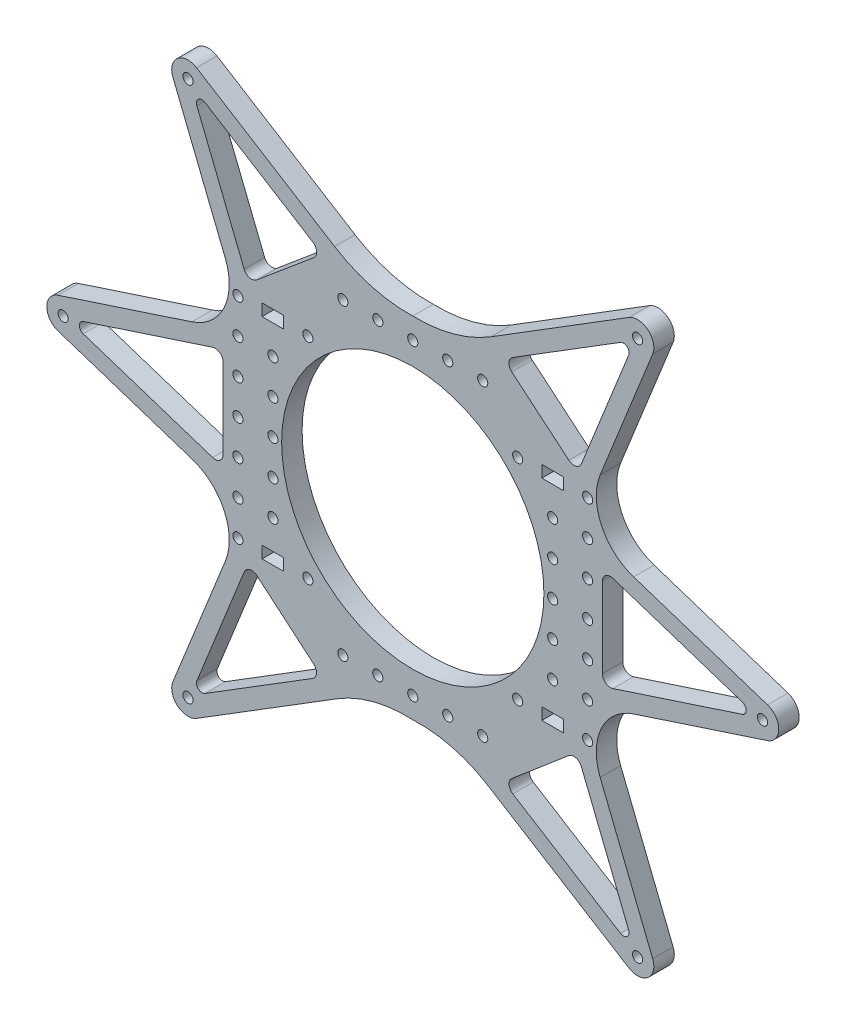
from build123d import *

# Parameters (mm, degrees)
SKETCH1_R           = 1.450000006
SKETCH1_R_2         = 1.45
SKETCH1_R_3         = 37.5
SKETCH1_W           = 6.2
SKETCH1_H           = 3.4
BOSS_EXTRUDE1_DEPTH = 5.85


with BuildPart() as part:
    # Sketch1 → Boss-Extrude1 (new body)
    with BuildSketch(Plane.XY):
        with BuildLine():
            Line((587.995290395, 497.753361998), (603.001149052, 460.347016836))
            ThreePointArc((603.001149052, 460.347016836), (602.663461243, 448.032016356), (593.446685098, 439.857402764))
            Line((593.446685098, 439.857402764), (555.146182231, 427.30822221))
            ThreePointArc((555.146182231, 427.30822221), (551.939243509, 422.882775531), (555.146182231, 418.457328853))
            Line((555.146182231, 418.457328853), (593.452097774, 405.906374832))
            ThreePointArc((593.452097774, 405.906374832), (602.673069636, 397.726980073), (603.008552552, 385.405605479))
            Line((603.008552552, 385.405605479), (587.996958268, 348.012810768))
            ThreePointArc((587.996958268, 348.012810768), (589.323596956, 342.712965063), (594.773022858, 342.32297527))
            Line((594.773022858, 342.32297527), (634.994066481, 367.293384987))
            ThreePointArc((634.994066481, 367.293384987), (645.369310006, 371.733785793), (656.596182238, 372.882775531))
            ThreePointArc((656.596182238, 372.882775531), (667.823054469, 371.733785793), (678.198297995, 367.293384987))
            Line((678.198297995, 367.293384987), (718.419341617, 342.32297527))
            ThreePointArc((718.419341617, 342.32297527), (723.86876752, 342.712965063), (725.195406208, 348.012810768))
            Line((725.195406208, 348.012810768), (710.183811924, 385.405605479))
            ThreePointArc((710.183811924, 385.405605479), (710.51929484, 397.726980073), (719.740266702, 405.906374832))
            Line((719.740266702, 405.906374832), (758.046182244, 418.457328853))
            ThreePointArc((758.046182244, 418.457328853), (761.253120966, 422.882775531), (758.046182244, 427.30822221))
            Line((758.046182244, 427.30822221), (719.745679378, 439.857402764))
            ThreePointArc((719.745679378, 439.857402764), (710.528903233, 448.032016356), (710.191215423, 460.347016836))
            Line((710.191215423, 460.347016836), (725.197074081, 497.753361998))
            ThreePointArc((725.197074081, 497.753361998), (723.86836572, 503.054641878), (718.416896408, 503.442606583))
            Line((718.416896408, 503.442606583), (678.956477699, 478.92021162))
            ThreePointArc((678.956477699, 478.92021162), (668.220713078, 474.255672819), (656.596182238, 472.882775531))
            ThreePointArc((656.596182238, 472.882775531), (644.971651398, 474.255672819), (634.235886777, 478.92021162))
            Line((634.235886777, 478.92021162), (594.775468067, 503.442606583))
            ThreePointArc((594.775468067, 503.442606583), (589.323998755, 503.054641878), (587.995290395, 497.753361998))
        make_face()
        with Locations((592.317421269, 499.487219843)):
            Circle(SKETCH1_R, mode=Mode.SUBTRACT)
        with Locations((706.596182238, 432.882775531)):
            Circle(SKETCH1_R_2, mode=Mode.SUBTRACT)
        with Locations((706.596182238, 442.882775531)):
            Circle(SKETCH1_R_2, mode=Mode.SUBTRACT)
        with Locations((706.596182238, 452.882775531)):
            Circle(SKETCH1_R_2, mode=Mode.SUBTRACT)
        with Locations((706.596182238, 392.882775531)):
            Circle(SKETCH1_R_2, mode=Mode.SUBTRACT)
        with Locations((556.596182238, 422.882775531)):
            Circle(SKETCH1_R, mode=Mode.SUBTRACT)
        with Locations((646.596182238, 378.882775531)):
            Circle(SKETCH1_R_2, mode=Mode.SUBTRACT)
        with Locations((656.596182238, 422.882775531)):
            Circle(SKETCH1_R_3, mode=Mode.SUBTRACT)
        with Locations((636.596182238, 378.882775531)):
            Circle(SKETCH1_R_2, mode=Mode.SUBTRACT)
        with Locations((706.596182238, 402.882775531)):
            Circle(SKETCH1_R_2, mode=Mode.SUBTRACT)
        with Locations((656.596182238, 466.882775531)):
            Circle(SKETCH1_R_2, mode=Mode.SUBTRACT)
        with Locations((696.596182238, 432.882775531)):
            Circle(SKETCH1_R_2, mode=Mode.SUBTRACT)
        with Locations((592.317421269, 346.278331219)):
            Circle(SKETCH1_R, mode=Mode.SUBTRACT)
        with Locations((706.596182238, 412.882775531)):
            Circle(SKETCH1_R_2, mode=Mode.SUBTRACT)
        with Locations((656.596182238, 378.882775531)):
            Circle(SKETCH1_R_2, mode=Mode.SUBTRACT)
        with Locations((696.596182238, 442.882775531)):
            Circle(SKETCH1_R_2, mode=Mode.SUBTRACT)
        with Locations((696.596182238, 402.882775531)):
            Circle(SKETCH1_R_2, mode=Mode.SUBTRACT)
        with Locations((696.596182238, 412.882775531)):
            Circle(SKETCH1_R_2, mode=Mode.SUBTRACT)
        with Locations((646.596182238, 466.882775531)):
            Circle(SKETCH1_R_2, mode=Mode.SUBTRACT)
        with Locations((636.596182238, 466.882775531)):
            Circle(SKETCH1_R_2, mode=Mode.SUBTRACT)
        with Locations((696.596182238, 422.882775531)):
            Circle(SKETCH1_R_2, mode=Mode.SUBTRACT)
        with Locations((676.596182238, 466.882775531)):
            Circle(SKETCH1_R_2, mode=Mode.SUBTRACT)
        with Locations((666.596182238, 466.882775531)):
            Circle(SKETCH1_R_2, mode=Mode.SUBTRACT)
        with Locations((706.596182238, 422.882775531)):
            Circle(SKETCH1_R_2, mode=Mode.SUBTRACT)
        with Locations((686.596182238, 452.882775531)):
            Circle(SKETCH1_R_2, mode=Mode.SUBTRACT)
        with Locations((686.596182238, 392.882775531)):
            Circle(SKETCH1_R_2, mode=Mode.SUBTRACT)
        with Locations((626.596182238, 392.882775531)):
            Circle(SKETCH1_R_2, mode=Mode.SUBTRACT)
        with Locations((720.874943207, 346.278331219)):
            Circle(SKETCH1_R, mode=Mode.SUBTRACT)
        with Locations((676.596182238, 378.882775531)):
            Circle(SKETCH1_R_2, mode=Mode.SUBTRACT)
        with Locations((666.596182238, 378.882775531)):
            Circle(SKETCH1_R_2, mode=Mode.SUBTRACT)
        with Locations((756.596182238, 422.882775531)):
            Circle(SKETCH1_R, mode=Mode.SUBTRACT)
        with Locations((626.596182238, 452.882775531)):
            Circle(SKETCH1_R_2, mode=Mode.SUBTRACT)
        with Locations((606.596182238, 422.882775531)):
            Circle(SKETCH1_R_2, mode=Mode.SUBTRACT)
        with Locations((616.596182238, 422.882775531)):
            Circle(SKETCH1_R_2, mode=Mode.SUBTRACT)
        with Locations((616.596182238, 412.882775531)):
            Circle(SKETCH1_R_2, mode=Mode.SUBTRACT)
        with Locations((720.874943207, 499.487219843)):
            Circle(SKETCH1_R, mode=Mode.SUBTRACT)
        with Locations((616.596182238, 402.882775531)):
            Circle(SKETCH1_R_2, mode=Mode.SUBTRACT)
        with Locations((616.596182238, 442.882775531)):
            Circle(SKETCH1_R_2, mode=Mode.SUBTRACT)
        with Locations((606.596182238, 412.882775531)):
            Circle(SKETCH1_R_2, mode=Mode.SUBTRACT)
        with Locations((616.596182238, 432.882775531)):
            Circle(SKETCH1_R_2, mode=Mode.SUBTRACT)
        with Locations((606.596182238, 402.882775531)):
            Circle(SKETCH1_R_2, mode=Mode.SUBTRACT)
        with Locations((606.596182238, 392.882775531)):
            Circle(SKETCH1_R_2, mode=Mode.SUBTRACT)
        with Locations((606.596182238, 452.882775531)):
            Circle(SKETCH1_R_2, mode=Mode.SUBTRACT)
        with Locations((606.596182238, 442.882775531)):
            Circle(SKETCH1_R_2, mode=Mode.SUBTRACT)
        with Locations((606.596182238, 432.882775531)):
            Circle(SKETCH1_R_2, mode=Mode.SUBTRACT)
        with BuildLine():
            Line((594.852213644, 494.089955534), (608.369257372, 460.394902501))
            ThreePointArc((608.369257372, 460.394902501), (609.936297881, 459.027594122), (611.962982661, 459.494174197))
            Line((611.962982661, 459.494174197), (628.291466753, 473.195399177))
            ThreePointArc((628.291466753, 473.195399177), (629.102888547, 475.11027328), (628.028466383, 476.890937531))
            Line((628.028466383, 476.890937531), (597.192526929, 496.053711548))
            ThreePointArc((597.192526929, 496.053711548), (595.310843783, 495.919797808), (594.852213644, 494.089955534))
        make_face(mode=Mode.SUBTRACT)
        with Locations((696.596182238, 392.882775531)):
            Rectangle(SKETCH1_W, SKETCH1_H, mode=Mode.SUBTRACT)
        with BuildLine():
            Line((562.360059701, 421.35524452), (599.360059701, 409.232174436))
            ThreePointArc((599.360059701, 409.232174436), (601.41475291, 409.553708225), (602.360059701, 411.406150729))
            Line((602.360059701, 411.406150729), (602.360059701, 434.359400333))
            ThreePointArc((602.360059701, 434.359400333), (601.41475291, 436.211842837), (599.360059701, 436.533376627))
            Line((599.360059701, 436.533376627), (562.360059701, 424.410306542))
            ThreePointArc((562.360059701, 424.410306542), (561.253120966, 422.882775531), (562.360059701, 421.35524452))
        make_face(mode=Mode.SUBTRACT)
        with BuildLine():
            Line((594.898108576, 351.782271539), (608.402798376, 385.421476261))
            ThreePointArc((608.402798376, 385.421476261), (609.970079979, 386.785234899), (611.992989402, 386.311899168))
            Line((611.992989402, 386.311899168), (628.261981584, 372.530251169))
            ThreePointArc((628.261981584, 372.530251169), (629.067265264, 370.610532007), (627.98909134, 368.829705105))
            Line((627.98909134, 368.829705105), (597.192616868, 349.710345781))
            ThreePointArc((597.192616868, 349.710345781), (595.265912021, 349.883123244), (594.898108576, 351.782271539))
        make_face(mode=Mode.SUBTRACT)
        with Locations((616.596182238, 452.882775531)):
            Rectangle(SKETCH1_W, SKETCH1_H, mode=Mode.SUBTRACT)
        with Locations((696.596182238, 452.882775531)):
            Rectangle(SKETCH1_W, SKETCH1_H, mode=Mode.SUBTRACT)
        with BuildLine():
            Line((715.999747608, 349.710345781), (685.203273136, 368.829705105))
            ThreePointArc((685.203273136, 368.829705105), (684.125099211, 370.610532007), (684.930382892, 372.530251169))
            Line((684.930382892, 372.530251169), (701.199375074, 386.311899168))
            ThreePointArc((701.199375074, 386.311899168), (703.222284496, 386.785234899), (704.7895661, 385.421476261))
            Line((704.7895661, 385.421476261), (718.2942559, 351.782271539))
            ThreePointArc((718.2942559, 351.782271539), (717.926452455, 349.883123244), (715.999747608, 349.710345781))
        make_face(mode=Mode.SUBTRACT)
        with BuildLine():
            Line((750.832304774, 424.410306542), (713.832304774, 436.533376627))
            ThreePointArc((713.832304774, 436.533376627), (711.777611566, 436.211842837), (710.832304774, 434.359400333))
            Line((710.832304774, 434.359400333), (710.832304774, 411.406150729))
            ThreePointArc((710.832304774, 411.406150729), (711.777611565, 409.553708225), (713.832304774, 409.232174436))
            Line((713.832304774, 409.232174436), (750.832304774, 421.35524452))
            ThreePointArc((750.832304774, 421.35524452), (751.939243509, 422.882775531), (750.832304774, 424.410306542))
        make_face(mode=Mode.SUBTRACT)
        with BuildLine():
            Line((684.900897722, 473.195399177), (701.229381815, 459.494174197))
            ThreePointArc((701.229381815, 459.494174197), (703.256066594, 459.027594122), (704.823107103, 460.394902501))
            Line((704.823107103, 460.394902501), (718.340150832, 494.089955534))
            ThreePointArc((718.340150832, 494.089955534), (717.881520693, 495.919797808), (715.999837547, 496.053711548))
            Line((715.999837547, 496.053711548), (685.163898093, 476.890937531))
            ThreePointArc((685.163898093, 476.890937531), (684.089475929, 475.11027328), (684.900897722, 473.195399177))
        make_face(mode=Mode.SUBTRACT)
        with Locations((616.596182238, 392.882775531)):
            Rectangle(SKETCH1_W, SKETCH1_H, mode=Mode.SUBTRACT)
    extrude(amount=BOSS_EXTRUDE1_DEPTH)


solid = part.part
